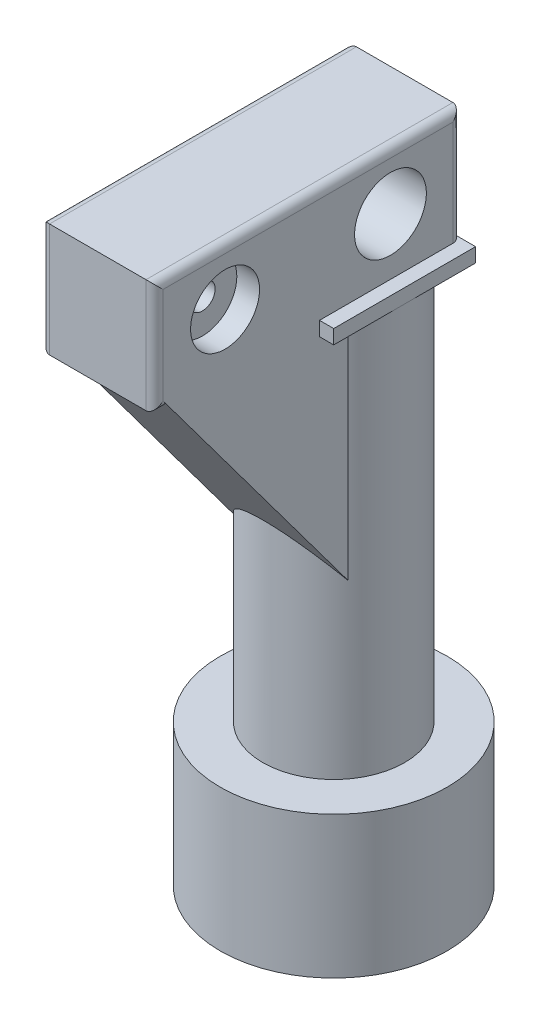
from build123d import *

# Parameters (mm, degrees)
CROQUIS1_R               = 40
CROQUIS1_R_2             = 6
SALIENTE_EXTRUIR1_DEPTH  = 30
SALIENTE_EXTRUIR2_START  = 20
CROQUIS2_R               = 40
CROQUIS2_R_2             = 35.3
SALIENTE_EXTRUIR2_DEPTH  = 20
CROQUIS6_R               = 6
CORTAR_EXTRUIR3_DEPTH    = 25
CROQUIS7_R               = 25
CROQUIS7_R_2             = 21
SALIENTE_EXTRUIR3_DEPTH  = 140
CROQUIS9_W               = 50
CROQUIS9_H               = 50
CROQUIS9_R               = 6
SALIENTE_EXTRUIR4_DEPTH  = 5
CROQUIS17_W              = 40
CROQUIS17_H              = 50
SALIENTE_EXTRUIR9_DEPTH  = 40
CROQUIS18_W              = 58.160908148
CROQUIS18_H              = 40
SALIENTE_EXTRUIR10_DEPTH = 40
REDONDEO1_R              = 3
CROQUIS19_R              = 12.65
CROQUIS19_R_2            = 4.5
CORTAR_EXTRUIR7_DEPTH    = 40
CROQUIS20_R              = 12.15
CORTAR_EXTRUIR8_DEPTH    = 8
CORTAR_EXTRUIR9_START    = -8
CROQUIS21_R              = 12.15
CORTAR_EXTRUIR9_DEPTH    = 8
SALIENTE_EXTRUIR11_DEPTH = 40


with BuildPart() as part:
    # Croquis1 → Saliente-Extruir1 (new body)
    with BuildSketch(Plane(origin=(0, 0, 0), x_dir=(1, 0, 0), z_dir=(0, 1, 0))):
        Circle(CROQUIS1_R)
        Circle(CROQUIS1_R_2, mode=Mode.SUBTRACT)
    extrude(amount=SALIENTE_EXTRUIR1_DEPTH)

    # Croquis2 → Saliente-Extruir2 (add)
    with BuildSketch(Plane.XZ.offset(SALIENTE_EXTRUIR2_START)):
        Circle(CROQUIS2_R)
        Circle(CROQUIS2_R_2, mode=Mode.SUBTRACT)
    extrude(amount=-SALIENTE_EXTRUIR2_DEPTH)

    # Croquis6 → Cortar-Extruir3 (cut)
    with BuildSketch(Plane.XZ):
        Polygon((-3.453364776, -6.205181039), (3.647162027, -6.093292144), (7.100526803, 0.111888895), (3.453364776, 6.205181039), (-3.647162027, 6.093292144), (-7.100526803, -0.111888895), align=None)
        Circle(CROQUIS6_R, mode=Mode.SUBTRACT)
    extrude(amount=-CORTAR_EXTRUIR3_DEPTH, mode=Mode.SUBTRACT)

    # Croquis7 → Saliente-Extruir3 (add)
    with BuildSketch(Plane(origin=(0, 30, 0), x_dir=(1, 0, 0), z_dir=(0, 1, 0))):
        Circle(CROQUIS7_R)
        Circle(CROQUIS7_R_2, mode=Mode.SUBTRACT)
    extrude(amount=SALIENTE_EXTRUIR3_DEPTH)

    # Croquis9 → Saliente-Extruir4 (add)
    with BuildSketch(Plane(origin=(0, 170, 0), x_dir=(1, 0, 0), z_dir=(0, 1, 0))):
        Rectangle(CROQUIS9_W, CROQUIS9_H)
        Circle(CROQUIS9_R, mode=Mode.SUBTRACT)
    extrude(amount=SALIENTE_EXTRUIR4_DEPTH)

    # Croquis17 → Saliente-Extruir9 (add)
    with BuildSketch(Plane(origin=(0, 175, 0), x_dir=(1, 0, 0), z_dir=(0, 1, 0))):
        Rectangle(CROQUIS17_W, CROQUIS17_H)
    extrude(amount=SALIENTE_EXTRUIR9_DEPTH)

    # Croquis18 → Saliente-Extruir10 (add)
    with BuildSketch(Plane.ZY.offset(20)):
        with Locations((54.080454074, 195)):
            Rectangle(CROQUIS18_W, CROQUIS18_H)
    extrude(amount=-SALIENTE_EXTRUIR10_DEPTH)

    # Redondeo1
    redondeo1_edges = [part.edges().sort_by_distance(p)[0] for p in [
        (-20, 175, 54.080454074),
        (-20, 195, 83.160908148),
        (-20, 215, 29.080454074),
        (-20, 195, -25),
        (20, 195, -25),
        (20, 175, 54.080454074),
        (20, 195, 83.160908148),
        (20, 215, 29.080454074),
    ]]
    fillet(redondeo1_edges, radius=REDONDEO1_R)

    # Croquis19 → Cortar-Extruir7 (cut)
    with BuildSketch(Plane.ZY.offset(20)):
        with Locations((0, 195)):
            Circle(CROQUIS19_R)
        with Locations((58.296529275, 195)):
            Circle(CROQUIS19_R_2)
    extrude(amount=-CORTAR_EXTRUIR7_DEPTH, mode=Mode.SUBTRACT)

    # Croquis20 → Cortar-Extruir8 (cut)
    with BuildSketch(Plane.ZY.offset(20)):
        with Locations((58.296529275, 195)):
            Circle(CROQUIS20_R)
    extrude(amount=-CORTAR_EXTRUIR8_DEPTH, mode=Mode.SUBTRACT)

    # Croquis21 → Cortar-Extruir9 (cut)
    with BuildSketch(Plane(origin=(20, 0, 0), x_dir=(0, 0, -1), z_dir=(1, 0, 0)).offset(CORTAR_EXTRUIR9_START)):
        with Locations((-58.296529275, 195)):
            Circle(CROQUIS21_R)
    extrude(amount=CORTAR_EXTRUIR9_DEPTH, mode=Mode.SUBTRACT)

    # Croquis22 → Saliente-Extruir11 (add)
    with BuildSketch(Plane(origin=(20, 0, 0), x_dir=(0, 0, -1), z_dir=(1, 0, 0))):
        Polygon((-80.160908148, 178), (-13.008016213, 178), (-13.008016213, 87.984326583), align=None)
    extrude(amount=-SALIENTE_EXTRUIR11_DEPTH)


solid = part.part
